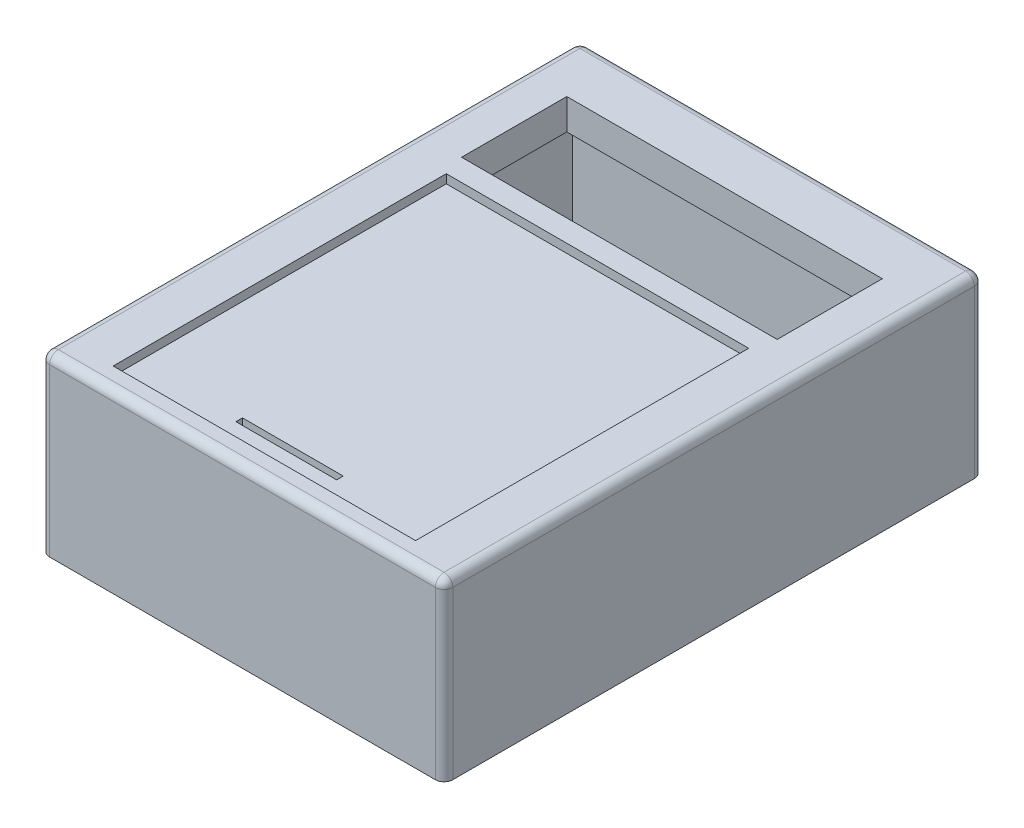
from build123d import *

# Parameters (mm, degrees)
SKETCH1_W           = 92
SKETCH1_H           = 123
BOSS_EXTRUDE1_DEPTH = 40
SKETCH2_W           = 72
SKETCH2_H           = 24
CUT_EXTRUDE1_DEPTH  = 159.723029205
SKETCH3_W           = 69
SKETCH3_H           = 76
CUT_EXTRUDE2_DEPTH  = 2
SKETCH5_W           = 23
SKETCH5_H           = 1.5
CUT_EXTRUDE4_DEPTH  = 159.230844022
FILLET1_R           = 2
SHELL10_START       = 7
SHELL10_DEPTH       = 24
SKETCH8_W           = 83.82309106
SKETCH8_H           = 110.483157271
CUT_EXTRUDE6_DEPTH  = 33


# Read off the part's stored shape, not the designer's step: Shell10
with BuildPart() as part:
    # Sketch1 → Boss-Extrude1 (new body)
    with BuildSketch(Plane(origin=(0, 0, 0), x_dir=(1, 0, 0), z_dir=(0, 1, 0))):
        with Locations((46, 61.5)):
            Rectangle(SKETCH1_W, SKETCH1_H)
    extrude(amount=BOSS_EXTRUDE1_DEPTH)

    # Sketch2 → Cut-Extrude1 (cut, through all)
    with BuildSketch(Plane(origin=(0, 40, 0), x_dir=(1, 0, 0), z_dir=(0, 1, 0))):
        with Locations((46, 98)):
            Rectangle(SKETCH2_W, SKETCH2_H)
    extrude(amount=-CUT_EXTRUDE1_DEPTH, mode=Mode.SUBTRACT)

    # Sketch3 → Cut-Extrude2 (cut)
    with BuildSketch(Plane(origin=(0, 40, 0), x_dir=(1, 0, 0), z_dir=(0, 1, 0))):
        with Locations((46, 43)):
            Rectangle(SKETCH3_W, SKETCH3_H)
    extrude(amount=-CUT_EXTRUDE2_DEPTH, mode=Mode.SUBTRACT)

    # Sketch5 → Cut-Extrude4 (cut, through all)
    with BuildSketch(Plane(origin=(0, 38, 0), x_dir=(1, 0, 0), z_dir=(0, 1, 0))):
        with Locations((46, 10.75)):
            Rectangle(SKETCH5_W, SKETCH5_H)
    extrude(amount=-CUT_EXTRUDE4_DEPTH, mode=Mode.SUBTRACT)

    # Fillet1
    fillet1_edges = [part.edges().sort_by_distance(p)[0] for p in [
        (92, 40, -61.5),
        (46, 40, -123),
        (0, 40, -61.5),
        (0, 20, -123),
        (92, 20, -123),
        (92, 20, 0),
        (0, 20, 0),
        (46, 40, 0),
    ]]
    fillet(fillet1_edges, radius=FILLET1_R)

    # Shell10 outline → Shell10 (cut)
    with BuildSketch(Plane(origin=(0, 0, 0), x_dir=(1, 0, 0), z_dir=(0, 1, 0)).offset(SHELL10_START)):
        Polygon((7, 7), (27.5, 7), (27.5, 18.5), (64.5, 18.5), (64.5, 7), (85, 7), (85, 79), (7, 79), align=None)
    extrude(amount=SHELL10_DEPTH, mode=Mode.SUBTRACT)

    # Sketch8 → Cut-Extrude6 (cut)
    with BuildSketch(Plane.XZ):
        with Locations((45.787286948, -62.167007368)):
            Rectangle(SKETCH8_W, SKETCH8_H)
    extrude(amount=-CUT_EXTRUDE6_DEPTH, mode=Mode.SUBTRACT)


solid = part.part
